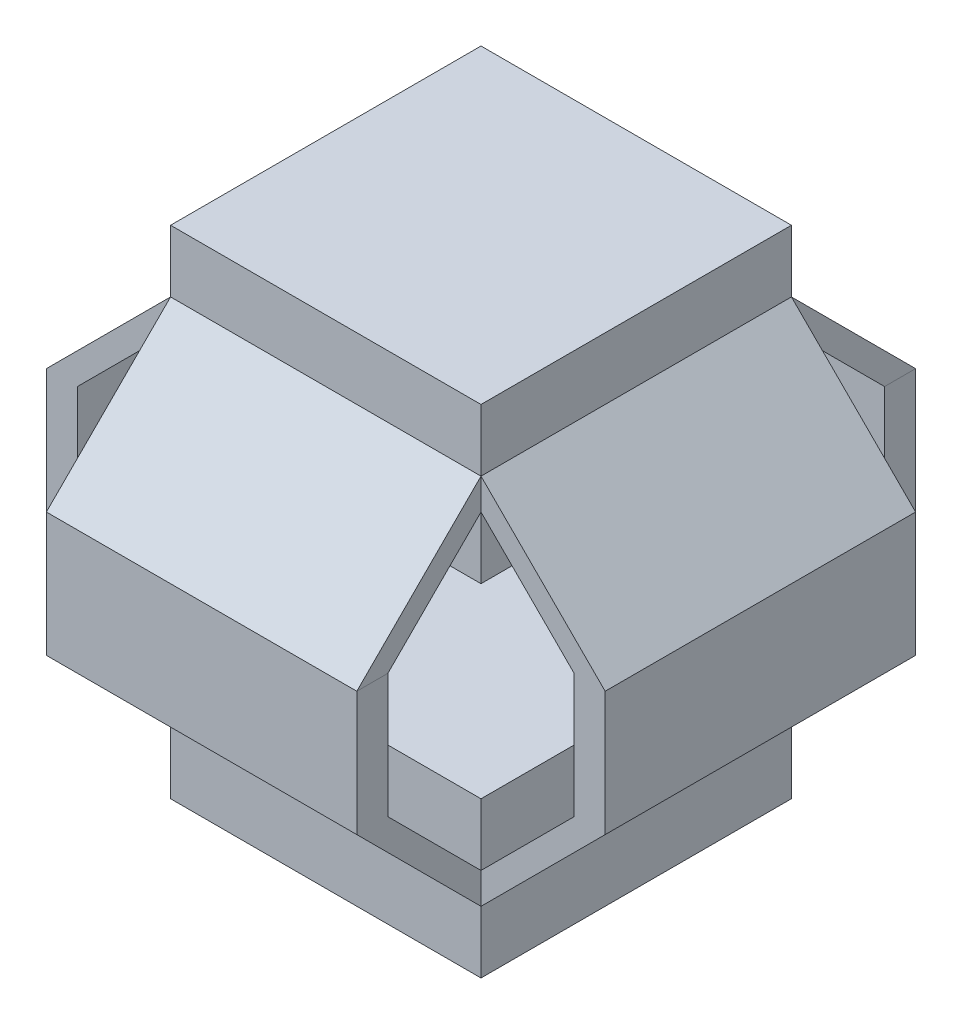
from build123d import *

# Parameters (mm, degrees)
SKETCH2_W            = 5
SKETCH2_H            = 5
BOSS_EXTRUDE1_DEPTH  = 2.5
BOSS_EXTRUDE2_DEPTH  = 5
BOSS_EXTRUDE3_DEPTH  = 5
SKETCH5_W            = 0.5
SKETCH5_H            = 5
BOSS_EXTRUDE4_DEPTH  = 1
SKETCH6_W            = 5
SKETCH6_H            = 0.5
BOSS_EXTRUDE5_DEPTH  = 1
MIRROR3_START        = -2.5
MIRROR3_OUTLINE_W    = 0.5
MIRROR3_OUTLINE_H    = 1
MIRROR3_DEPTH        = 5
MIRROR5_COPY_1_DEPTH = 5
MIRROR5_COPY_2_DEPTH = 5
MIRROR6_START        = -2.5
MIRROR6_OUTLINE_W    = 1
MIRROR6_OUTLINE_H    = 0.5
MIRROR6_DEPTH        = 5
BOSS_EXTRUDE7_DEPTH  = 5
BOSS_EXTRUDE9_DEPTH  = 5


# Read off the part's stored shape, not the designer's step: Mirror3, Mirror6
with BuildPart() as part:
    # Sketch2 → Boss-Extrude1 (new body)
    with BuildSketch(Plane(origin=(0, 0, 0), x_dir=(1, 0, 0), z_dir=(0, 1, 0))):
        Rectangle(SKETCH2_W, SKETCH2_H)
    boss_extrude1 = extrude(amount=BOSS_EXTRUDE1_DEPTH)

    # Sketch3 → Boss-Extrude2 (add)
    with BuildSketch(Plane.XY.offset(2.5)):
        Polygon((-2.5, 1.5), (-4, 3), (-4.5, 3), (-2.5, 1), align=None)
    boss_extrude2 = extrude(amount=-BOSS_EXTRUDE2_DEPTH)

    # Sketch4 → Boss-Extrude3 (add)
    with BuildSketch(Plane(origin=(2.5, 0, 0), x_dir=(0, 0, -1), z_dir=(1, 0, 0))):
        Polygon((2.5, 1.5), (2.5, 1), (4.5, 3), (4, 3), align=None)
    boss_extrude3 = extrude(amount=-BOSS_EXTRUDE3_DEPTH)

    # Sketch5 → Boss-Extrude4 (add)
    with BuildSketch(Plane(origin=(0, 3, 0), x_dir=(1, 0, 0), z_dir=(0, 1, 0))):
        with Locations((-4.25, 0)):
            Rectangle(SKETCH5_W, SKETCH5_H)
    boss_extrude4 = extrude(amount=BOSS_EXTRUDE4_DEPTH)

    # Sketch6 → Boss-Extrude5 (add)
    with BuildSketch(Plane(origin=(0, 3, 0), x_dir=(1, 0, 0), z_dir=(0, 1, 0))):
        with Locations((0, 4.25)):
            Rectangle(SKETCH6_W, SKETCH6_H)
    boss_extrude5 = extrude(amount=BOSS_EXTRUDE5_DEPTH)

    # Mirror1: Boss-Extrude3, Boss-Extrude5 across plane
    add(boss_extrude3.mirror(Plane.XY))
    add(boss_extrude5.mirror(Plane.XY))

    # Mirror2: Boss-Extrude2, Boss-Extrude4 across plane
    add(boss_extrude2.mirror(Plane(origin=(0, 0, 0), x_dir=(0, 0, 1), z_dir=(1, 0, 0))))
    add(boss_extrude4.mirror(Plane(origin=(0, 0, 0), x_dir=(0, 0, 1), z_dir=(1, 0, 0))))

    # Mirror3 outline → Mirror3 (add)
    with BuildSketch(Plane.XY.offset(MIRROR3_START)):
        with Locations((-4.25, 4.5)):
            Rectangle(MIRROR3_OUTLINE_W, MIRROR3_OUTLINE_H)
        with Locations((4.25, 4.5)):
            Rectangle(MIRROR3_OUTLINE_W, MIRROR3_OUTLINE_H)
    extrude(amount=MIRROR3_DEPTH)

    # Mirror4: Boss-Extrude2 across plane
    add(boss_extrude2.mirror(Plane.ZX.offset(4)))

    # Mirror5 copy 1 sketch → Mirror5 copy 1 (add)
    with BuildSketch(Plane(origin=(0, 8, 2.5), x_dir=(-1, 0, 0), z_dir=(0, 0, 1))):
        Polygon((-2.5, 1.5), (-4, 3), (-4.5, 3), (-2.5, 1), align=None)
    extrude(amount=-MIRROR5_COPY_1_DEPTH)

    # Mirror5 copy 2 sketch → Mirror5 copy 2 (add)
    with BuildSketch(Plane(origin=(0, 0, 2.5), x_dir=(-1, 0, 0), z_dir=(0, 0, 1))):
        Polygon((-2.5, -1.5), (-4, -3), (-4.5, -3), (-2.5, -1), align=None)
    extrude(amount=-MIRROR5_COPY_2_DEPTH)

    # Mirror6 outline → Mirror6 (add)
    with BuildSketch(Plane.YZ.offset(MIRROR6_START)):
        with Locations((4.5, -4.25)):
            Rectangle(MIRROR6_OUTLINE_W, MIRROR6_OUTLINE_H)
        with Locations((4.5, 4.25)):
            Rectangle(MIRROR6_OUTLINE_W, MIRROR6_OUTLINE_H)
    extrude(amount=MIRROR6_DEPTH)

    # Mirror10: Boss-Extrude1 across plane
    add(boss_extrude1.mirror(Plane.ZX.offset(4)))


with BuildPart() as body_2:
    # Sketch7 → Boss-Extrude7 (new body)
    with BuildSketch(Plane.ZY.offset(2.5)):
        Polygon((-4.5, 5), (-4, 5), (-2.5, 6.5), (-2.5, 7), align=None)
    extrude(amount=-BOSS_EXTRUDE7_DEPTH)


with BuildPart() as body_3:
    # Sketch8 → Boss-Extrude9 (new body)
    with BuildSketch(Plane.ZY.offset(2.5)):
        Polygon((4.5, 5), (4, 5), (2.5, 6.5), (2.5, 7), align=None)
    extrude(amount=-BOSS_EXTRUDE9_DEPTH)


solid = Compound([part.part, body_2.part, body_3.part])
